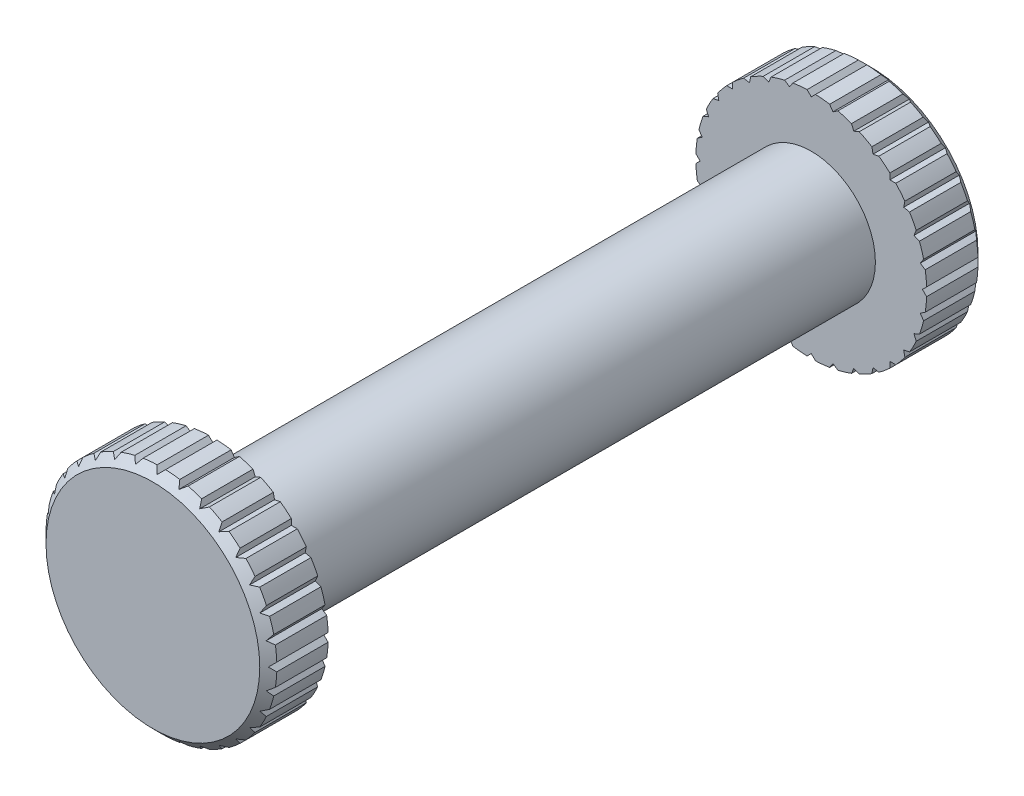
from build123d import *

# Parameters (mm, degrees)
SKETCH1_R           = 1.5
BOSS_EXTRUDE1_DEPTH = 7
SKETCH2_R           = 2.7
BOSS_EXTRUDE2_DEPTH = 1.4
CHAMFER1_SIZE       = 0.2
CUT_EXTRUDE1_REACH  = 17.866
CIRPATTERN1_COUNT   = 32


# Read off the part's stored shape, not the designer's step: Mirror2
with BuildPart() as part:
    # Sketch1 → Boss-Extrude1 (new, symmetric)
    with BuildSketch(Plane.XY):
        Circle(SKETCH1_R)
    extrude(amount=BOSS_EXTRUDE1_DEPTH, both=True)

    # Sketch2 → Boss-Extrude2 (add)
    with BuildSketch(Plane.XY.offset(7)):
        Circle(SKETCH2_R)
    extrude(amount=BOSS_EXTRUDE2_DEPTH)

    # Chamfer1
    chamfer1_edges = [part.edges().sort_by_distance(p)[0] for p in [
        (-2.7, 0, 8.4),
    ]]
    chamfer(chamfer1_edges, length=CHAMFER1_SIZE)

    # Sketch4 → Cut-Extrude1 (cut, up to next)
    with BuildSketch(Plane.XY.offset(8.4), mode=Mode.PRIVATE) as cut_extrude1_sk1:
        Polygon((0.1, 2.7), (0, 2.6), (-0.1, 2.7), align=None)
    cut_extrude1_tool1 = extrude(cut_extrude1_sk1.sketch, amount=-CUT_EXTRUDE1_REACH, mode=Mode.PRIVATE) & part.part
    cut_extrude1 = cut_extrude1_tool1.solids().sort_by_distance((0, 2.666667, 8.4))[0]
    add(cut_extrude1, mode=Mode.SUBTRACT)

    # CirPattern1: Cut-Extrude1 ×32 about axis
    cirpattern1_axis = Axis((0, 0, 0), (0, 0, 1))
    for i in range(1, CIRPATTERN1_COUNT):
        add(cut_extrude1.rotate(cirpattern1_axis, i * 360 / CIRPATTERN1_COUNT), mode=Mode.SUBTRACT)

    # Mirror2: part across plane


with BuildPart() as part_1:
    add(part.part)
    add(part.part.mirror(Plane.XY))


solid = part_1.part
